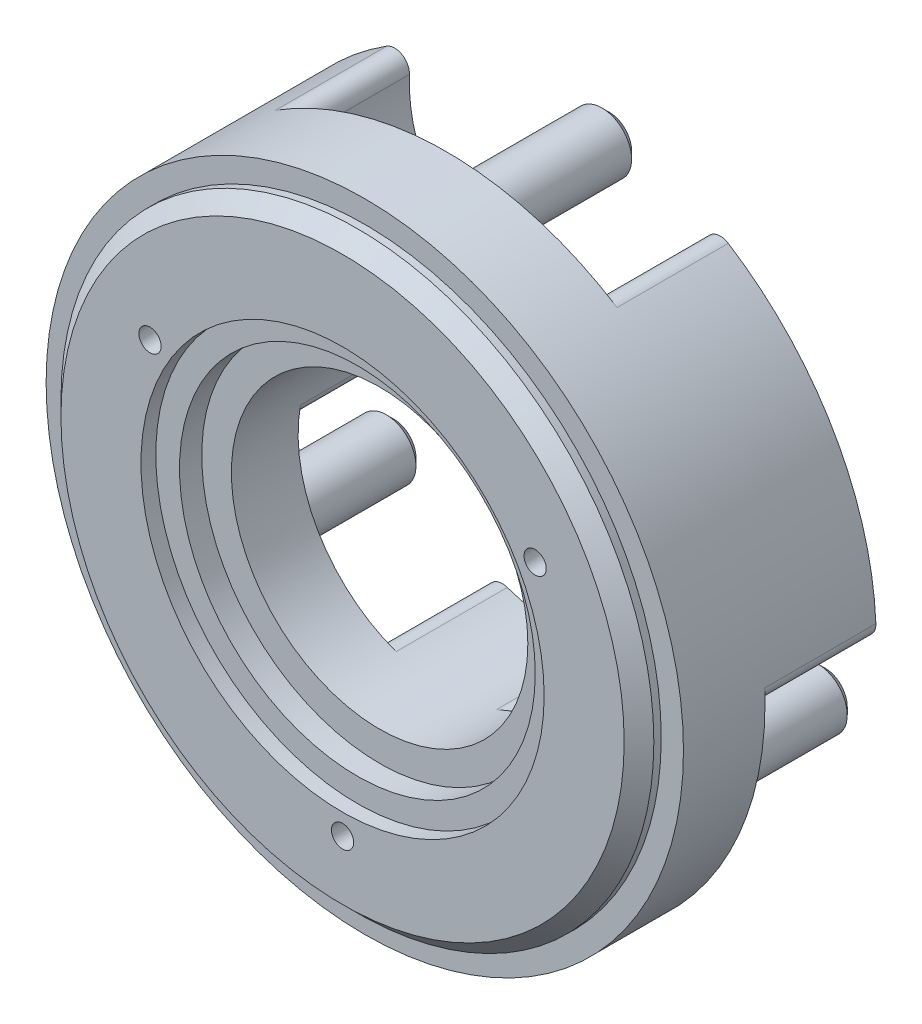
from build123d import *

# Parameters (mm, degrees)
SKETCH4_R                    = 4
BOSS_EXTRUDE1_DEPTH          = 0.5
SKETCH5_R                    = 2
BOSS_EXTRUDE2_DEPTH          = 10.5
CHAMFER1_SIZE                = 0.5
CIRPATTERN1_COUNT            = 3
CHAMFER1_OF_CIRPATTERN1_SIZE = 0.5
BOSS_EXTRUDE3_DEPTH          = 7.5
SKETCH7_R                    = 0.75
CUT_EXTRUDE1_DEPTH           = 2
CUT_EXTRUDE2_DEPTH           = 34.686050525
CHAMFER2_SIZE                = 0.2
CHAMFER3_SIZE                = 0.5
CIRPATTERN2_COUNT            = 3
CHAMFER2_OF_CIRPATTERN2_SIZE = 0.2
CHAMFER3_OF_CIRPATTERN2_SIZE = 0.5
CHAMFER4_SIZE                = 1
FILLET1_R                    = 1


with BuildPart() as part:
    # Sketch3 → Revolve1 (revolve)
    with BuildSketch(Plane(origin=(0, 0, 0), x_dir=(0, 0, -1), z_dir=(1, 0, 0)), mode=Mode.PRIVATE) as revolve1_sk:
        Polygon((1, 13.6), (1, 12), (2.5, 12), (2.5, 10), (7, 10), (7, 21.5), (1.5, 21.5), (1.5, 20), (0, 20), (0, 13.6), align=None)
    revolve(revolve1_sk.sketch.rotate(Axis((0, 0, 0), (0, 0, -1)), 90), axis=Axis((0, 0, 0), (0, 0, -1)))

    # Sketch4 → Boss-Extrude1 (add)
    with BuildSketch(Plane(origin=(0, 0, -7), x_dir=(-1, 0, 0), z_dir=(0, 0, -1))):
        with Locations(Location((0, 16.8, 0), (0, 0, 180))):
            Circle(SKETCH4_R)
    boss_extrude1 = extrude(amount=BOSS_EXTRUDE1_DEPTH)

    # Sketch5 → Boss-Extrude2 (add)
    with BuildSketch(Plane(origin=(0, 0, -7.5), x_dir=(-1, 0, 0), z_dir=(0, 0, -1))):
        with Locations(Location((0, 16.8, 0), (0, 0, 180))):
            Circle(SKETCH5_R)
    boss_extrude2 = extrude(amount=BOSS_EXTRUDE2_DEPTH)

    # Chamfer1
    chamfer1_edges = [part.edges().sort_by_distance(p)[0] for p in [
        (-2, 16.8, -18),
    ]]
    chamfer(chamfer1_edges, length=CHAMFER1_SIZE)

    # CirPattern1: Boss-Extrude1, Boss-Extrude2 ×3 about axis
    cirpattern1_axis = Axis((0, 0, 0), (0, 0, 1))
    add([boss_extrude1.rotate(cirpattern1_axis, i * 360 / CIRPATTERN1_COUNT) for i in range(1, CIRPATTERN1_COUNT)])
    add([boss_extrude2.rotate(cirpattern1_axis, i * 360 / CIRPATTERN1_COUNT) for i in range(1, CIRPATTERN1_COUNT)])

    # Chamfer1 of CirPattern1
    chamfer1_of_cirpattern1_edges = [part.edges().sort_by_distance(p)[0] for p in [
        (-13.549226784, -10.132050808, -18),
        (15.549226784, -6.667949192, -18),
    ]]
    chamfer(chamfer1_of_cirpattern1_edges, length=CHAMFER1_OF_CIRPATTERN1_SIZE)

    # Sketch6 → Boss-Extrude3 (add)
    with BuildSketch(Plane(origin=(0, 0, -7), x_dir=(-1, 0, 0), z_dir=(0, 0, -1))):
        with BuildLine():
            ThreePointArc((-4.561681399, -8.89893605), (-6.703398823, -14.60024061), (-11.755277198, -18.001762636))
            ThreePointArc((-11.755277198, -18.001762636), (0, -21.5), (11.755277198, -18.001762636))
            ThreePointArc((11.755277198, -18.001762636), (6.703398823, -14.60024061), (4.561681399, -8.89893605))
            ThreePointArc((4.561681399, -8.89893605), (0, -10), (-4.561681399, -8.89893605))
        make_face()
    boss_extrude3 = extrude(amount=BOSS_EXTRUDE3_DEPTH)

    # Sketch7 → Cut-Extrude1 (cut)
    with BuildSketch(Plane(origin=(0, 0, -14.5), x_dir=(-1, 0, 0), z_dir=(0, 0, -1))):
        with BuildLine():
            Line((-3.105828541, -11.591109915), (-4.658742812, -17.386664873))
            ThreePointArc((-4.658742812, -17.386664873), (0, -18), (4.658742812, -17.386664873))
            Line((4.658742812, -17.386664873), (3.105828541, -11.591109915))
            ThreePointArc((3.105828541, -11.591109915), (0, -12), (-3.105828541, -11.591109915))
        make_face()
        with Locations((0, -15)):
            Circle(SKETCH7_R, mode=Mode.SUBTRACT)
    cut_extrude1 = extrude(amount=-CUT_EXTRUDE1_DEPTH, mode=Mode.SUBTRACT)

    # Sketch7<3> → Cut-Extrude2 (cut, through all)
    with BuildSketch(Plane(origin=(0, 0, -14.5), x_dir=(-1, 0, 0), z_dir=(0, 0, -1))):
        with BuildLine():
            ThreePointArc((0.75, -15), (0.530330086, -14.469669914), (0, -14.25))
            Line((0, -14.25), (0, -15.75))
            ThreePointArc((0, -15.75), (0.530330086, -15.530330086), (0.75, -15))
        make_face()
        with BuildLine():
            Line((0, -15.75), (0, -14.25))
            ThreePointArc((0, -14.25), (-0.75, -15), (0, -15.75))
        make_face()
    cut_extrude2 = extrude(amount=-CUT_EXTRUDE2_DEPTH, mode=Mode.SUBTRACT)

    # Chamfer2
    chamfer2_edges = [part.edges().sort_by_distance(p)[0] for p in [
        (0, -15.75, -12.5),
    ]]
    chamfer(chamfer2_edges, length=CHAMFER2_SIZE)

    # Chamfer3
    chamfer3_edges = [part.edges().sort_by_distance(p)[0] for p in [
        (0, -12, -14.5),
        (3.882285677, -14.488887394, -14.5),
        (0, -18, -14.5),
        (-3.882285677, -14.488887394, -14.5),
    ]]
    chamfer(chamfer3_edges, length=CHAMFER3_SIZE)

    # CirPattern2: Boss-Extrude3, Cut-Extrude1, Cut-Extrude2 ×3 about axis
    cirpattern2_axis = Axis((0, 0, 0), (0, 0, 1))
    add([boss_extrude3.rotate(cirpattern2_axis, i * 360 / CIRPATTERN2_COUNT) for i in range(1, CIRPATTERN2_COUNT)])
    add([cut_extrude1.rotate(cirpattern2_axis, i * 360 / CIRPATTERN2_COUNT) for i in range(1, CIRPATTERN2_COUNT)], mode=Mode.SUBTRACT)
    add([cut_extrude2.rotate(cirpattern2_axis, i * 360 / CIRPATTERN2_COUNT) for i in range(1, CIRPATTERN2_COUNT)], mode=Mode.SUBTRACT)

    # Chamfer2 of CirPattern2
    chamfer2_of_cirpattern2_edges = [part.edges().sort_by_distance(p)[0] for p in [
        (13.63990011, 7.875, -12.5),
        (-13.63990011, 7.875, -12.5),
    ]]
    chamfer(chamfer2_of_cirpattern2_edges, length=CHAMFER2_OF_CIRPATTERN2_SIZE)

    # Chamfer3 of CirPattern2
    chamfer3_of_cirpattern2_edges = [part.edges().sort_by_distance(p)[0] for p in [
        (10.392304845, 6, -14.5),
        (10.606601718, 10.606601718, -14.5),
        (15.588457268, 9, -14.5),
        (14.488887394, 3.882285677, -14.5),
        (-10.392304845, 6, -14.5),
        (-14.488887394, 3.882285677, -14.5),
        (-15.588457268, 9, -14.5),
        (-10.606601718, 10.606601718, -14.5),
    ]]
    chamfer(chamfer3_of_cirpattern2_edges, length=CHAMFER3_OF_CIRPATTERN2_SIZE)

    # Chamfer4
    chamfer4_edges = [part.edges().sort_by_distance(p)[0] for p in [
        (-20, 0, 0),
    ]]
    chamfer(chamfer4_edges, length=CHAMFER4_SIZE)

    # Fillet1
    # the kernel refuses this fillet: 1 mm, written as the material it takes off along each edge
    with BuildSketch(Plane(origin=(21.467622355, -1.179487364, -7), x_dir=(0.006387197521753035, 0.9999796016458627, 0), z_dir=(0, 0, -1)), Plane(origin=(-9.712345156, 19.18125, -7), x_dir=(-0.8692013370524373, -0.49445832551010344, 0), z_dir=(0, 0, -1)), Plane(origin=(-11.755277198, -18.001762636, -7), x_dir=(0.862814139530684, -0.5055212761357581, 0), z_dir=(0, 0, -1))) as fillet1_piece_1:
        with BuildLine():
            CenterArc((2.036209541, -0.998824096), FILLET1_R, 87.221143718, 125.050734124)
            ThreePointArc((1.190685537, -1.532761506), (0.632617432, -0.737424909), (0, 0))
            ThreePointArc((0, 0), (1.04234536, 0.025281931), (2.084690721, 0))
        make_face()
    extrude(amount=12.711726802, mode=Mode.SUBTRACT)
    with BuildSketch(Plane(origin=(9.987545385, 0.49893605, -7), x_dir=(0.9173175626436978, 0.3981563628342837, 0), z_dir=(0, 0, -1)), Plane(origin=(-5.425863987, 8.4, -7), x_dir=(-0.8034723062147525, 0.5953421311699238, 0), z_dir=(0, 0, -1)), Plane(origin=(-4.561681399, -8.89893605, -7), x_dir=(-0.113845256428944, -0.9934984940042073, 0), z_dir=(0, 0, -1))) as fillet1_piece_2:
        with BuildLine():
            CenterArc((1.346819148, -0.99794128), FILLET1_R, 93.677145319, 99.571657965)
            ThreePointArc((0.373435102, -1.22712134), (0.20641295, -0.607567006), (0, 0))
            ThreePointArc((0, 0), (0.641342451, -0.020587199), (1.282684903, 0))
        make_face()
    extrude(amount=10.706712257, mode=Mode.SUBTRACT)
    with BuildSketch(Plane(origin=(5.425863987, 8.4, -7), x_dir=(0.8034723062147457, 0.595342131169933, 0), z_dir=(0, 0, -1)), Plane(origin=(-9.987545385, 0.49893605, -7), x_dir=(-0.9173175626437021, 0.3981563628342733, 0), z_dir=(0, 0, -1)), Plane(origin=(4.561681399, -8.89893605, -7), x_dir=(0.11384525642895783, -0.9934984940042058, 0), z_dir=(0, 0, -1))) as fillet1_piece_3:
        with BuildLine():
            CenterArc((1.346819148, 0.99794128), FILLET1_R, 166.751196715, 99.571657965)
            ThreePointArc((0.373435102, 1.22712134), (0.20641295, 0.607567006), (0, 0))
            ThreePointArc((0, 0), (0.641342451, 0.020587199), (1.282684903, 0))
        make_face()
    extrude(amount=10.706712257, mode=Mode.SUBTRACT)
    with BuildSketch(Plane(origin=(9.712345156, 19.18125, -7), x_dir=(0.8692013370524435, -0.4944583255100922, 0), z_dir=(0, 0, -1)), Plane(origin=(-21.467622355, -1.179487364, -7), x_dir=(-0.006387197521766656, 0.9999796016458625, 0), z_dir=(0, 0, -1)), Plane(origin=(11.755277198, -18.001762636, -7), x_dir=(-0.8628141395306765, -0.5055212761357707, 0), z_dir=(0, 0, -1))) as fillet1_piece_4:
        with BuildLine():
            CenterArc((2.036209541, 0.998824096), FILLET1_R, 147.728122158, 125.050734124)
            ThreePointArc((1.190685537, 1.532761506), (0.632617432, 0.737424909), (0, 0))
            ThreePointArc((0, 0), (1.04234536, -0.025281931), (2.084690721, 0))
        make_face()
    extrude(amount=12.711726802, mode=Mode.SUBTRACT)


solid = part.part
